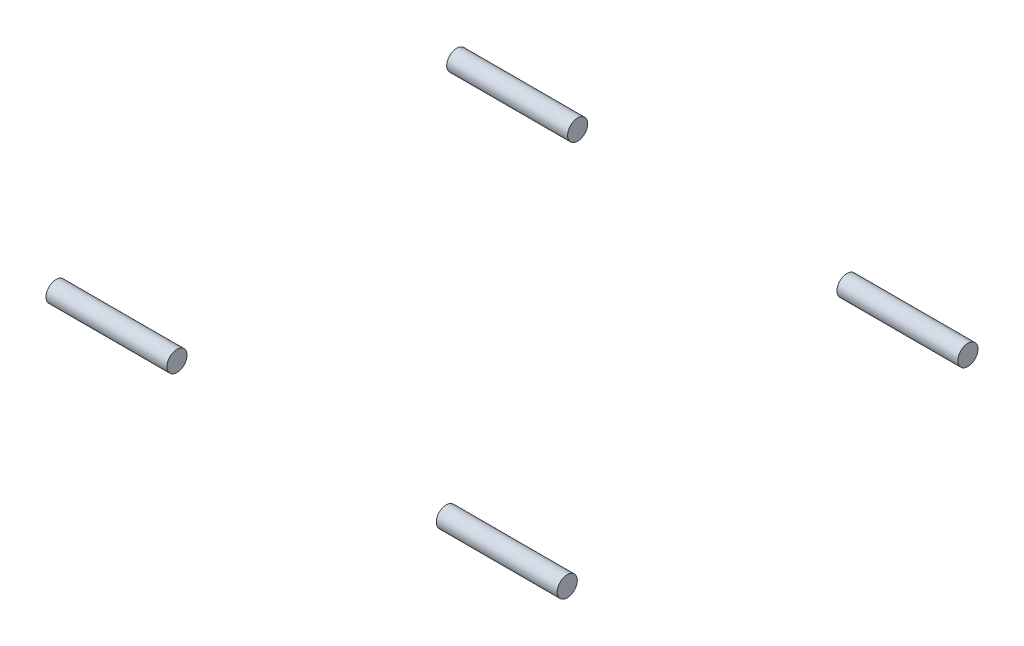
from build123d import *

# Parameters (mm, degrees)
SKETCH1_R             = 3.175
BOSS_EXTRUDE1_DEPTH   = 38.1
BOSS_EXTRUDE1_2_DEPTH = 38.1


with BuildPart() as part:
    # Sketch1 → Boss-Extrude1 (new body)
    with BuildSketch(Plane.ZY.offset(-80.53)):
        with Locations((126.249998656, 0)):
            Circle(SKETCH1_R)
    extrude(amount=BOSS_EXTRUDE1_DEPTH)


with BuildPart() as body_2:
    # Sketch1 → Boss-Extrude1 2 (new body)
    with BuildSketch(Plane.ZY.offset(-80.53)):
        Circle(SKETCH1_R)
    extrude(amount=BOSS_EXTRUDE1_2_DEPTH)


with BuildPart() as body_3:
    # Mirror1: mirrored copy
    add(part.part.mirror(Plane(origin=(0, 0, 0), x_dir=(0, 0, 1), z_dir=(1, 0, 0))))


with BuildPart() as body_4:
    # Mirror1 2: mirrored copy
    add(body_2.part.mirror(Plane(origin=(0, 0, 0), x_dir=(0, 0, 1), z_dir=(1, 0, 0))))


solid = Compound([part.part, body_2.part, body_3.part, body_4.part])
